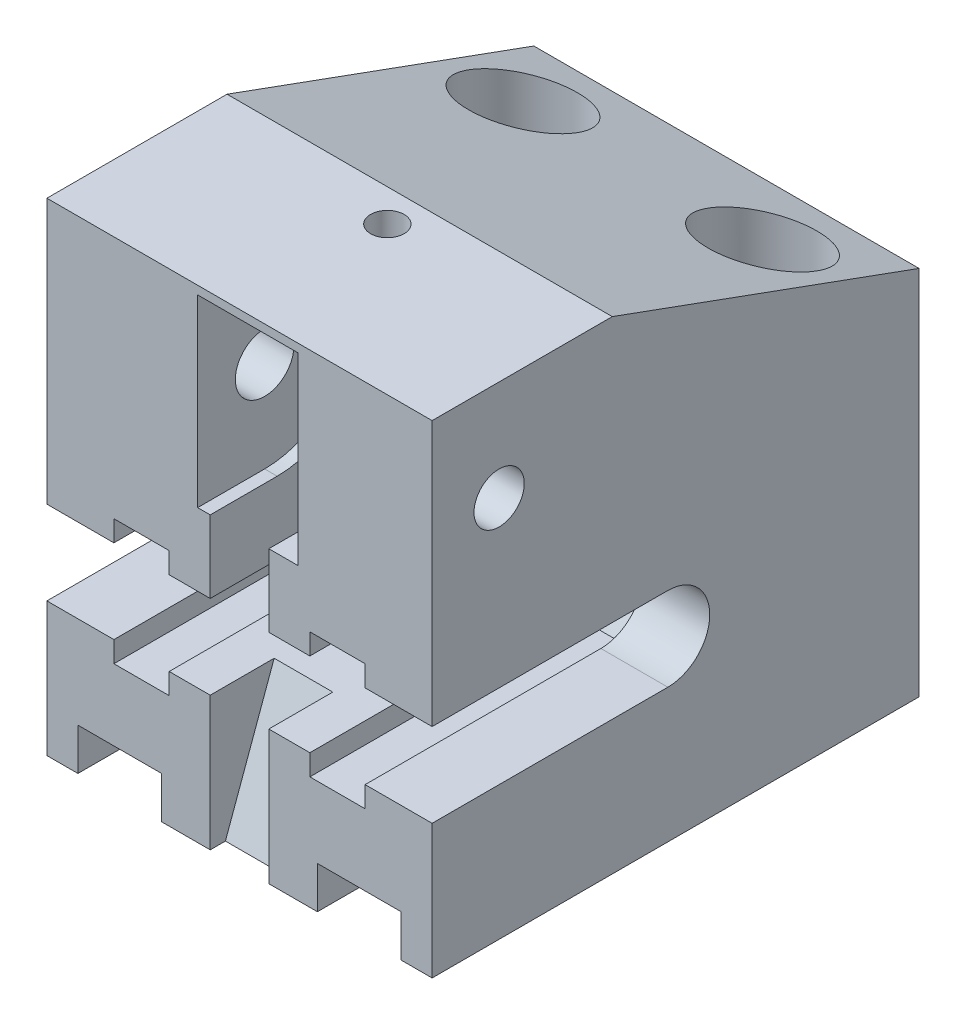
from build123d import *

# Parameters (mm, degrees)
SKETCH1_W                = 23
SKETCH1_H                = 32.5
BOSS_EXTRUDE1_DEPTH      = 18
SKETCH2_W                = 23
SKETCH2_H                = 25
BOSS_EXTRUDE2_DEPTH      = 15
CHAMFER1_SIZE            = 15
SKETCH3_R                = 1.8
CUT_EXTRUDE1_DEPTH       = 44.694965385
CUT_EXTRUDE2_DEPTH       = 44.694965385
CUT_EXTRUDE3_START       = -4
CUT_EXTRUDE3_DEPTH       = 3.3
SKETCH7_W                = 5
SKETCH7_H                = 2.5
CUT_EXTRUDE4_DEPTH       = 52.713151132
CUT_EXTRUDE5_START       = -6.5
SKETCH8_R                = 3.25
CUT_EXTRUDE5_DEPTH       = 38.194965385
SKETCH9_R                = 1
CUT_EXTRUDE6_DEPTH       = 8
CUT_EXTRUDE8_DEPTH       = 1.75
CUT_EXTRUDE7_DEPTH       = 1.75
CUT_EXTRUDE9_DEPTH       = 13
SKETCH15_R               = 1.35
CUT_EXTRUDE10_DEPTH      = 6
CUT_EXTRUDE11_DEPTH      = 2.5
CUT_EXTRUDE11_DEPTH_BACK = 3.5
SKETCH17_R               = 1.75
CUT_EXTRUDE12_DEPTH      = 9
SKETCH18_R               = 3
CUT_EXTRUDE13_DEPTH      = 3
SKETCH19_R               = 1.5
CUT_EXTRUDE14_DEPTH      = 44.694965459
SKETCH20_R               = 1.75
CUT_EXTRUDE15_DEPTH      = 8
SKETCH21_R               = 3
CUT_EXTRUDE16_DEPTH      = 3
SKETCH22_R               = 1.5
CUT_EXTRUDE17_DEPTH      = 17
CUT_EXTRUDE18_DEPTH      = 44.694965459


with BuildPart() as part:
    # Sketch1 → Boss-Extrude1 (new body)
    with BuildSketch(Plane.XY):
        with Locations((11.5, 16.25)):
            Rectangle(SKETCH1_W, SKETCH1_H)
    extrude(amount=BOSS_EXTRUDE1_DEPTH)

    # Sketch2 → Boss-Extrude2 (add)
    with BuildSketch(Plane(origin=(0, 0, 0), x_dir=(-1, 0, 0), z_dir=(0, 0, -1))):
        with Locations((-11.5, 12.5)):
            Rectangle(SKETCH2_W, SKETCH2_H)
    extrude(amount=BOSS_EXTRUDE2_DEPTH)

    # Chamfer1
    # the kernel refuses this chamfer: 15 mm, written as the material it adds along each edge
    with BuildSketch(Plane(origin=(23, 25, 0), x_dir=(0, -0.02749587661058632, -0.9996219169112968), z_dir=(-1, 0, 0))) as chamfer1_piece_1_section:
        Polygon((CHAMFER1_SIZE * 0.999621916911, -CHAMFER1_SIZE * 0.0274958766106), (-CHAMFER1_SIZE * 0.0274958766106, -CHAMFER1_SIZE * 0.999621916911), (0, 0), align=None)
    chamfer1_piece_1 = extrude(amount=23, mode=Mode.PRIVATE)
    chamfer1_piece_1 = split(chamfer1_piece_1, bisect_by=Plane(origin=(11.5, 28.131672391, -15), z_dir=(0, 0, 1)), keep=Keep.TOP, mode=Mode.PRIVATE)
    chamfer1_piece_1 = split(chamfer1_piece_1, bisect_by=Plane(origin=(11.5, 32.5, -5.879790556), z_dir=(0, -1, 0)), keep=Keep.TOP, mode=Mode.PRIVATE)
    add(chamfer1_piece_1)

    # Sketch3 → Cut-Extrude1 (cut, through all)
    with BuildSketch(Plane.XZ):
        with Locations(Location((4.35, -10, 0), (0, 0, 270))):
            Circle(SKETCH3_R)
        with Locations(Location((18.65, -10, 0), (0, 0, 270))):
            Circle(SKETCH3_R)
    extrude(amount=-CUT_EXTRUDE1_DEPTH, mode=Mode.SUBTRACT)

    # Sketch4 → Cut-Extrude2 (cut, through all)
    with BuildSketch(Plane.ZY):
        with BuildLine():
            Line((0, 13), (18, 13))
            Line((18, 13), (18, 8))
            Line((18, 8), (0, 8))
            ThreePointArc((0, 8), (-2.5, 10.5), (0, 13))
        make_face()
    extrude(amount=-CUT_EXTRUDE2_DEPTH, mode=Mode.SUBTRACT)

    # Sketch5 → Cut-Extrude3 (cut)
    with BuildSketch(Plane.ZY.offset(CUT_EXTRUDE3_START)):
        Polygon((2.165063509, 14.25), (-2.165063509, 14.25), (-4.330127019, 10.5), (-2.165063509, 6.75), (2.165063509, 6.75), (18, 6.75), (18, 14.25), align=None)
    cut_extrude3 = extrude(amount=-CUT_EXTRUDE3_DEPTH, mode=Mode.SUBTRACT)

    # Sketch7 → Cut-Extrude4 (cut, through all)
    with BuildSketch(Plane(origin=(0, 0, -15), x_dir=(-1, 0, 0), z_dir=(0, 0, -1))):
        with Locations((-4.35, 1.25)):
            Rectangle(SKETCH7_W, SKETCH7_H)
    cut_extrude4 = extrude(amount=-CUT_EXTRUDE4_DEPTH, mode=Mode.SUBTRACT)

    # Sketch8 → Cut-Extrude5 (cut, through all)
    with BuildSketch(Plane.XZ.offset(CUT_EXTRUDE5_START)):
        with Locations(Location((4.35, -10, 0), (0, 0, 270))):
            Circle(SKETCH8_R)
    cut_extrude5 = extrude(amount=-CUT_EXTRUDE5_DEPTH, mode=Mode.SUBTRACT)

    # Mirror1: Cut-Extrude3, Cut-Extrude4, Cut-Extrude5 across plane
    add(cut_extrude3.mirror(Plane.ZY.offset(-11.5)), mode=Mode.SUBTRACT)
    add(cut_extrude4.mirror(Plane.ZY.offset(-11.5)), mode=Mode.SUBTRACT)
    add(cut_extrude5.mirror(Plane.ZY.offset(-11.5)), mode=Mode.SUBTRACT)

    # Sketch9 → Cut-Extrude6 (cut)
    with BuildSketch(Plane(origin=(0, 32.5, 0), x_dir=(1, 0, 0), z_dir=(0, 1, 0))):
        with Locations(Location((11.5, -5.25, 0), (0, 0, 270))):
            Circle(SKETCH9_R)
    extrude(amount=-CUT_EXTRUDE6_DEPTH, mode=Mode.SUBTRACT)

    # Sketch10 → Cut-Extrude8 (cut, symmetric)
    with BuildSketch(Plane.ZY.offset(-11.5)):
        Polygon((4.25, 24.5), (18, -13.277814518), (31.330171166, -4.978014809), (56.797179747, 10.878576059), (6.25, 24.5), align=None)
    extrude(amount=CUT_EXTRUDE8_DEPTH, both=True, mode=Mode.SUBTRACT)

    # Sketch11 → Cut-Extrude7 (cut, symmetric)
    with BuildSketch(Plane.ZY.offset(-11.5)):
        Polygon((1.029605681, 24.137976813), (5.29394834, 23.386058148), (6.774939004, 19.317069741), (3.991587008, 16), (-15, 9.087627628), (-15, 18.303677479), align=None)
    extrude(amount=CUT_EXTRUDE7_DEPTH, both=True, mode=Mode.SUBTRACT)

    # Sketch12 → Cut-Revolve2 (revolve, cut)
    with BuildSketch(Plane.ZY.offset(-11.5)):
        Polygon((0.20282315, 23.485738747), (1.570903724, 19.726968263), (-16.480990664, 13.156616034), (-17.849071237, 16.915386518), align=None)
    revolve(axis=Axis((11.5, 19.726968263, 1.570903724), (0, -0.34202014332567215, -0.9396926207859072)), mode=Mode.SUBTRACT)

    # Sketch13 → Cut-Extrude9 (cut)
    with BuildSketch(Plane(origin=(0, -3.757856581, -10.324626103), x_dir=(1, 0, 0), z_dir=(0, 0.34202014332567177, 0.9396926207859073))):
        with BuildLine():
            Line((18.65, 21.250005791), (11.5, 21.250005791))
            Line((11.5, 21.250005791), (11.5, 14.750005791))
            Line((11.5, 14.750005791), (18.65, 14.750005791))
            ThreePointArc((18.65, 14.750005791), (21.9, 18.000005791), (18.65, 21.250005791))
        make_face()
    cut_extrude9 = extrude(amount=CUT_EXTRUDE9_DEPTH, mode=Mode.SUBTRACT)

    # Sketch15 → Cut-Extrude10 (cut)
    with BuildSketch(Plane(origin=(0, 0.688405282, 1.891377967), x_dir=(-1, 0, 0), z_dir=(0, -0.34202014332567177, -0.9396926207859073))):
        with Locations(Location((-18.65, 18.000005791, 0), (0, 0, 90))):
            Circle(SKETCH15_R)
    cut_extrude10 = extrude(amount=-CUT_EXTRUDE10_DEPTH, mode=Mode.SUBTRACT)

    # Mirror2: Cut-Extrude9, Cut-Extrude10 across plane
    add(cut_extrude9.mirror(Plane.ZY.offset(-11.5)), mode=Mode.SUBTRACT)
    add(cut_extrude10.mirror(Plane.ZY.offset(-11.5)), mode=Mode.SUBTRACT)

    # Sketch16 → Cut-Extrude11 (cut, two sides: drawn at the far end of the back side and taken through both)
    with BuildSketch(Plane.ZY.offset(-11.5).offset(-CUT_EXTRUDE11_DEPTH_BACK)):
        with BuildLine():
            Line((10.075121942, 28.322250561), (25.575121942, 28.322250561))
            Line((25.575121942, 28.322250561), (25.575121942, 17.322250561))
            Line((25.575121942, 17.322250561), (10.075121942, 17.322250561))
            ThreePointArc((10.075121942, 17.322250561), (4.575121942, 22.822250561), (10.075121942, 28.322250561))
        make_face()
    extrude(amount=CUT_EXTRUDE11_DEPTH + CUT_EXTRUDE11_DEPTH_BACK, mode=Mode.SUBTRACT)

    # Sketch17 → Cut-Extrude12 (cut)
    with BuildSketch(Plane.ZY):
        with Locations((10.075121942, 22.822250561)):
            Circle(SKETCH17_R)
    extrude(amount=-CUT_EXTRUDE12_DEPTH, mode=Mode.SUBTRACT)

    # Sketch18 → Cut-Extrude13 (cut)
    with BuildSketch(Plane.ZY):
        with Locations((10.075121942, 22.822250561)):
            Circle(SKETCH18_R)
    extrude(amount=-CUT_EXTRUDE13_DEPTH, mode=Mode.SUBTRACT)

    # Sketch19 → Cut-Extrude14 (cut, through all)
    with BuildSketch(Plane.ZY):
        with Locations((10.075121942, 22.822250561)):
            Circle(SKETCH19_R)
    extrude(amount=-CUT_EXTRUDE14_DEPTH, mode=Mode.SUBTRACT)

    # Sketch20 → Cut-Extrude15 (cut)
    with BuildSketch(Plane.XZ):
        with Locations(Location((11.5, 5, 0), (0, 0, 270))):
            Circle(SKETCH20_R)
    extrude(amount=-CUT_EXTRUDE15_DEPTH, mode=Mode.SUBTRACT)

    # Sketch21 → Cut-Extrude16 (cut)
    with BuildSketch(Plane.XZ):
        with Locations(Location((11.5, 5, 0), (0, 0, 270))):
            Circle(SKETCH21_R)
    extrude(amount=-CUT_EXTRUDE16_DEPTH, mode=Mode.SUBTRACT)

    # Sketch22 → Cut-Extrude17 (cut)
    with BuildSketch(Plane.XZ):
        with Locations(Location((11.5, 5, 0), (0, 0, 222.242919533))):
            Circle(SKETCH22_R)
    extrude(amount=-CUT_EXTRUDE17_DEPTH, mode=Mode.SUBTRACT)

    # Sketch23 → Cut-Extrude18 (cut, through all)
    with BuildSketch(Plane(origin=(0, 0, 0), x_dir=(0, 0, -1), z_dir=(1, 0, 0))):
        Polygon((-18, 32.5), (-14.075121942, 32.5), (-13.4247686, 32.5), (15, 32.5), (15, 22.154230314), (-3.320235061, 28.822250561), (-14.075121942, 28.822250561), (-14.075121942, 0), (-18, 0), align=None)
    extrude(amount=CUT_EXTRUDE18_DEPTH, mode=Mode.SUBTRACT)


solid = part.part
